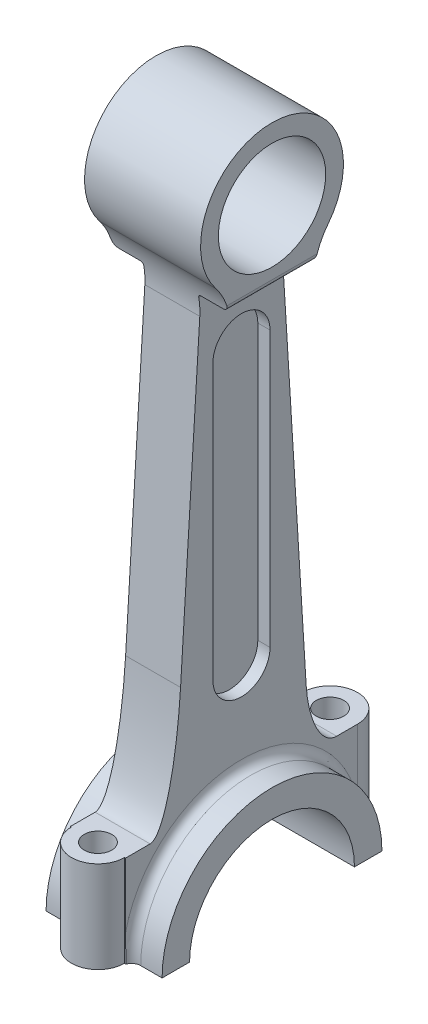
from build123d import *
from build123d.topology import SkipClean

# Parameters (mm, degrees)
SKETCH1_R           = 17.570830407171474
BOSS_EXTRUDE3_DEPTH = 38
FILLET1_R           = 22.5
FILLET2_R           = 22.5
SKETCH3_R           = 9
SKETCH3_R_2         = 4.500000000000003
BOSS_EXTRUDE4_DEPTH = 29.999999999999986
SKETCH4_R           = 8.67583436061811
SKETCH4_R_2         = 4.500000000000003
BOSS_EXTRUDE5_DEPTH = 29.999999999999986
SKETCH5_R           = 4.500000000000003
CUT_EXTRUDE1_DEPTH  = 29.999999999999986
SKETCH6_R           = 4.500000000000003
CUT_EXTRUDE2_DEPTH  = 29.999999999999986
CUT_EXTRUDE6_DEPTH  = 14
CUT_EXTRUDE8_DEPTH  = 10
FILLET6_R           = 5
FILLET7_R           = 5
FILLET8_R           = 5
SKETCH8_W           = 61.099488033744805
SKETCH8_H           = 148.01571546286905
CUT_EXTRUDE9_DEPTH  = 10
SKETCH9_W           = 61.099488033744805
SKETCH9_H           = 148.11204122589925
CUT_EXTRUDE10_DEPTH = 10
CUT_EXTRUDE11_DEPTH = 4
FILLET10_R          = 2
FILLET11_R          = 1
CUT_EXTRUDE12_DEPTH = 10
CUT_EXTRUDE15_DEPTH = 10.000000000000002
BOSS_EXTRUDE6_DEPTH = 10
BOSS_EXTRUDE7_START = 10
BOSS_EXTRUDE7_DEPTH = 10
FILLET13_R          = 3


# Read off the part's stored shape, not the designer's step: Cut-Extrude12
with BuildPart() as part:
    # Sketch1 → Boss-Extrude3 (new body)
    with BuildSketch(Plane(origin=(0, 0, 0), x_dir=(0, 0, -1), z_dir=(1, 0, 0))):
        with BuildLine():
            ThreePointArc((-26.999999999999975, -111.09985895627645), (-19.091883092036756, -92.00797586423968), (2.297e-14, -84.09985895627648))
            ThreePointArc((2.297e-14, -84.09985895627648), (19.09188309203677, -92.0079758642397), (26.999999999999968, -111.09985895627645))
            Line((26.99999999999997, -111.09985895627646), (38.000000000000064, -111.09985895627645))
            Line((38.000000000000064, -111.09985895627645), (38.000000000000064, -81.09985895627645))
            Line((38.000000000000064, -81.09985895627645), (22.38144614284805, -81.09985895627645))
            Line((22.38144614284805, -81.09985895627645), (13.019036711468793, 70.66453904439737))
            ThreePointArc((13.01903671146879, 70.66453904439737), (5.33e-15, 113.49325844972108), (-13.019036711468797, 70.66453904439739))
            Line((-13.019036711468793, 70.66453904439737), (-22.38144614284805, -81.09985895627645))
            Line((-22.38144614284805, -81.09985895627645), (-37.999999999999936, -81.09985895627645))
            Line((-37.999999999999936, -81.09985895627645), (-37.999999999999936, -111.09985895627645))
            Line((-37.999999999999936, -111.09985895627645), (-26.99999999999997, -111.09985895627646))
        make_face()
        with Locations((0, 90.10014104372357)):
            Circle(SKETCH1_R, mode=Mode.SUBTRACT)
    extrude(amount=BOSS_EXTRUDE3_DEPTH)

    # Fillet1
    fillet1_edges = [part.edges().sort_by_distance(p)[0] for p in [
        (19, 70.66453904439737, -13.019036711468793),
    ]]
    fillet(fillet1_edges, radius=FILLET1_R)

    # Fillet2
    fillet2_edges = [part.edges().sort_by_distance(p)[0] for p in [
        (19, 70.66453904439739, 13.019036711468797),
    ]]
    fillet(fillet2_edges, radius=FILLET2_R)

    # Fillet4
    # an asymmetric fillet: 40, 10 mm, written as the material it adds along each edge
    with BuildSketch(Plane(origin=(0, -81.09985895627645, 22.38144614284805), x_dir=(0, 0.9981025601612018, -0.06157336599256649), z_dir=(1, 0, 0))) as fillet4_piece_1:
        with BuildLine():
            Bezier((39.45913767991283, 1e-17), (1.418e-14, 8.8e-16), (-0.46496472653524684, 7.537065360297337), weights=[1, 0.7285510846854072, 1])
            Line((-0.46496472653524684, 7.537065360297337), (0, 0))
            Line((0, 0), (39.45913767991283, 1e-17))
        make_face()
    extrude(amount=38)

    # Fillet5
    # an asymmetric fillet: 20, 10 mm, written as the material it adds along each edge
    with BuildSketch(Plane(origin=(0, -81.09985895627645, -22.38144614284805), x_dir=(0, 0.9981025601612017, 0.06157336599256639), z_dir=(1, 0, 0))) as fillet5_piece_1:
        with BuildLine():
            Bezier((19.42111674069207, -1.6e-16), (0, 0), (-0.5409344625319603, -8.76853268014867), weights=[1, 0.7285510846854072, 1])
            Line((-0.5409344625319603, -8.76853268014867), (0, 0))
            Line((0, 0), (19.42111674069207, -1.6e-16))
        make_face()
    extrude(amount=38)

    # Sketch3 → Boss-Extrude4 (add)
    with BuildSketch(Plane.XZ.offset(111.09985895627645)):
        with Locations((19, -38.000000000000064)):
            Circle(SKETCH3_R)
        with Locations((19, -38.000000000000064)):
            Circle(SKETCH3_R_2, mode=Mode.SUBTRACT)
    extrude(amount=-BOSS_EXTRUDE4_DEPTH)

    # Sketch4 → Boss-Extrude5 (add)
    with BuildSketch(Plane.XZ.offset(111.09985895627645)):
        with Locations((19, 37.999999999999936)):
            Circle(SKETCH4_R)
        with Locations((19, 37.999999999999936)):
            Circle(SKETCH4_R_2, mode=Mode.SUBTRACT)
    extrude(amount=-BOSS_EXTRUDE5_DEPTH)

    # Sketch5 → Cut-Extrude1 (cut)
    with BuildSketch(Plane(origin=(0, -111.09985895627645, 0), x_dir=(-1, 0, 0), z_dir=(0, -1, 0))):
        with Locations(Location((-19, -37.999999999999936, 0), (0, 0, 90))):
            Circle(SKETCH5_R)
    extrude(amount=-CUT_EXTRUDE1_DEPTH, mode=Mode.SUBTRACT)

    # Sketch6 → Cut-Extrude2 (cut)
    with BuildSketch(Plane.XZ.offset(111.09985895627645)):
        with Locations(Location((19, -38.000000000000064, 0), (0, 0, 270))):
            Circle(SKETCH6_R)
    extrude(amount=-CUT_EXTRUDE2_DEPTH, mode=Mode.SUBTRACT)

    # Sketch2 → Cut-Extrude6 (cut)
    with BuildSketch(Plane(origin=(38, 0, 0), x_dir=(0, 0, -1), z_dir=(1, 0, 0))):
        with BuildLine():
            Line((-9.351264742477943, 45.00000000000001), (-9.351264742477934, -44.99999999999999))
            ThreePointArc((-9.351264742477934, -44.99999999999999), (5.78e-15, -54.35126474247793), (9.351264742477943, -44.99999999999999))
            Line((9.351264742477943, -44.99999999999999), (9.351264742477934, 45.00000000000001))
            ThreePointArc((9.351264742477934, 45.00000000000001), (-4.63e-15, 54.351264742477944), (-9.351264742477943, 45.00000000000001))
        make_face()
    extrude(amount=-CUT_EXTRUDE6_DEPTH, mode=Mode.SUBTRACT)

    # Sketch7 → Cut-Extrude8 (cut)
    with BuildSketch(Plane(origin=(38, 0, 0), x_dir=(0, 0, -1), z_dir=(1, 0, 0))):
        Polygon((-11.569503857235707, 58.83449515944963), (11.893669496617798, 58.83449515944963), (11.893669496617807, -80.34746579739416), (-11.569503857235699, -80.34746579739416), align=None)
    extrude(amount=-CUT_EXTRUDE8_DEPTH, mode=Mode.SUBTRACT)

    # Fillet6
    fillet6_edges = [part.edges().sort_by_distance(p)[0] for p in [
        (33, -80.34746579739416, 11.569503857235699),
    ]]
    fillet(fillet6_edges, radius=FILLET6_R)

    # Fillet7
    fillet7_edges = [part.edges().sort_by_distance(p)[0] for p in [
        (33, -80.34746579739416, -11.893669496617807),
    ]]
    fillet(fillet7_edges, radius=FILLET7_R)

    # Fillet8
    fillet8_edges = [part.edges().sort_by_distance(p)[0] for p in [
        (33, 58.83449515944963, 11.569503857235707),
        (33, 58.83449515944963, -11.893669496617798),
    ]]
    fillet(fillet8_edges, radius=FILLET8_R)

    # Sketch8 → Cut-Extrude9 (cut)
    with BuildSketch(Plane(origin=(38, 0, 0), x_dir=(0, 0, -1), z_dir=(1, 0, 0))):
        with Locations((0.6169041985286743, -7.092001224841923)):
            Rectangle(SKETCH8_W, SKETCH8_H)
    extrude(amount=-CUT_EXTRUDE9_DEPTH, mode=Mode.SUBTRACT)

    # Sketch9 → Cut-Extrude10 (cut)
    with BuildSketch(Plane.ZY):
        with Locations((-0.6169041985286743, -7.043838343326826)):
            Rectangle(SKETCH9_W, SKETCH9_H)
    extrude(amount=-CUT_EXTRUDE10_DEPTH, mode=Mode.SUBTRACT)

    # Sketch10 → Cut-Extrude11 (cut)
    with BuildSketch(Plane.ZY.offset(-10)):
        with BuildLine():
            Line((9.999999999999993, 45), (10.000000000000004, -45))
            ThreePointArc((10.000000000000004, -45), (2.5e-15, -55), (-9.999999999999995, -45))
            Line((-9.999999999999995, -45), (-10.000000000000007, 45))
            ThreePointArc((-10.000000000000007, 45), (-6.33e-15, 55), (9.999999999999993, 45))
        make_face()
    extrude(amount=-CUT_EXTRUDE11_DEPTH, mode=Mode.SUBTRACT)

    # Fillet10
    fillet10_edges = [part.edges().sort_by_distance(p)[0] for p in [
        (38, 66.9158565065926, -7.11e-15),
        (0, 67.0121822696228, -1.066e-14),
    ]]
    fillet(fillet10_edges, radius=FILLET10_R)

    # Fillet11
    fillet11_edges = [part.edges().sort_by_distance(p)[0] for p in [
        (28, 66.9158565065926, 7.11e-15),
        (10, 67.0121822696228, 1.066e-14),
    ]]
    fillet(fillet11_edges, radius=FILLET11_R)

    # Cut-Extrude12 outline → Cut-Extrude12 (cut)
    with BuildSketch(Plane(origin=(0, 0, 0), x_dir=(0, 0, -1), z_dir=(1, 0, 0))):
        with BuildLine():
            ThreePointArc((-27, -111.099858956), (0, -84.099858956), (27, -111.099858956))
            Line((27, -111.099858956), (38, -111.099858956))
            Line((38, -111.099858956), (38, -81.099858956))
            Line((38, -81.099858956), (22.381446143, -81.099858956))
            Line((22.381446143, -81.099858956), (13.019036711, 70.664539044))
            ThreePointArc((13.019036711, 70.664539044), (0, 66.707023638), (-13.019036711, 70.664539044))
            Line((-13.019036711, 70.664539044), (-22.381446143, -81.099858956))
            Line((-22.381446143, -81.099858956), (-38, -81.099858956))
            Line((-38, -81.099858956), (-38, -111.099858956))
            Line((-38, -111.099858956), (-27, -111.099858956))
        make_face()
        with BuildLine():
            ThreePointArc((-19.899748742, -81.099858956), (0, -75.099858956), (19.899748742, -81.099858956))
            Line((19.899748742, -81.099858956), (-19.899748742, -81.099858956))
        make_face(mode=Mode.SUBTRACT)
    extrude(amount=CUT_EXTRUDE12_DEPTH, mode=Mode.SUBTRACT)

    # Sketch13 → Cut-Extrude15 (cut)
    with BuildSketch(Plane(origin=(38, 0, 0), x_dir=(0, 0, -1), z_dir=(1, 0, 0))):
        with BuildLine():
            ThreePointArc((19.89974874213295, -81.09985895627682), (31.72058444225757, -94.07621297071839), (36, -111.09985895627645))
            Line((36, -111.09985895627645), (38.000000000000064, -111.09985895627645))
            Line((38.000000000000064, -111.09985895627645), (38.000000000000064, -81.09985895627645))
            Line((38.000000000000064, -81.09985895627645), (19.899748742133053, -81.09985895627645))
        make_face()
        with BuildLine():
            Line((-37.999999999999936, -111.09985895627645), (-36, -111.09985895627645))
            ThreePointArc((-36, -111.09985895627645), (-31.72058444225739, -94.07621297071806), (-19.89974874213232, -81.09985895627639))
            Line((-19.89974874213231, -81.09985895627645), (-37.999999999999936, -81.09985895627645))
            Line((-37.999999999999936, -81.09985895627645), (-37.999999999999936, -111.09985895627645))
        make_face()
    extrude(amount=-CUT_EXTRUDE15_DEPTH, mode=Mode.SUBTRACT)

    # Sketch16 → Boss-Extrude6 (add)
    with BuildSketch(Plane.ZY.offset(-10)):
        with BuildLine():
            ThreePointArc((36, -111.09985895627645), (2.2e-15, -75.09985895627645), (-36, -111.09985895627645))
            Line((-36, -111.09985895627645), (-26.99999999999997, -111.09985895627645))
            ThreePointArc((-26.99999999999998, -111.09985895627645), (-1.2e-16, -84.09985895627648), (26.99999999999997, -111.09985895627645))
            Line((26.99999999999997, -111.09985895627645), (36, -111.09985895627645))
        make_face()
    extrude(amount=BOSS_EXTRUDE6_DEPTH)

    # Sketch20 → Boss-Extrude7 (add)
    with SkipClean():  # the faces are left unmerged after this step: merging them gives an invalid solid
        with BuildSketch(Plane(origin=(27.999999999999996, 0, 0), x_dir=(0, 0, -1), z_dir=(1, 0, 0)).offset(BOSS_EXTRUDE7_START)):
            with BuildLine():
                ThreePointArc((19.899748742132395, -81.09985895627645), (2.2e-15, -75.09985895627645), (-19.899748742132385, -81.09985895627644))
                Line((-19.899748742132395, -81.09985895627645), (19.899748742132395, -81.09985895627645))
            make_face()
        extrude(amount=-BOSS_EXTRUDE7_DEPTH)

    # Fillet13
    fillet13_edges = [part.edges().sort_by_distance(p)[0] for p in [
        (10, -75.09985895627645, 2.2e-15),
        (27.999999999999996, -75.09985895627645, -3.55e-15),
    ]]
    fillet(fillet13_edges, radius=FILLET13_R)


solid = part.part
